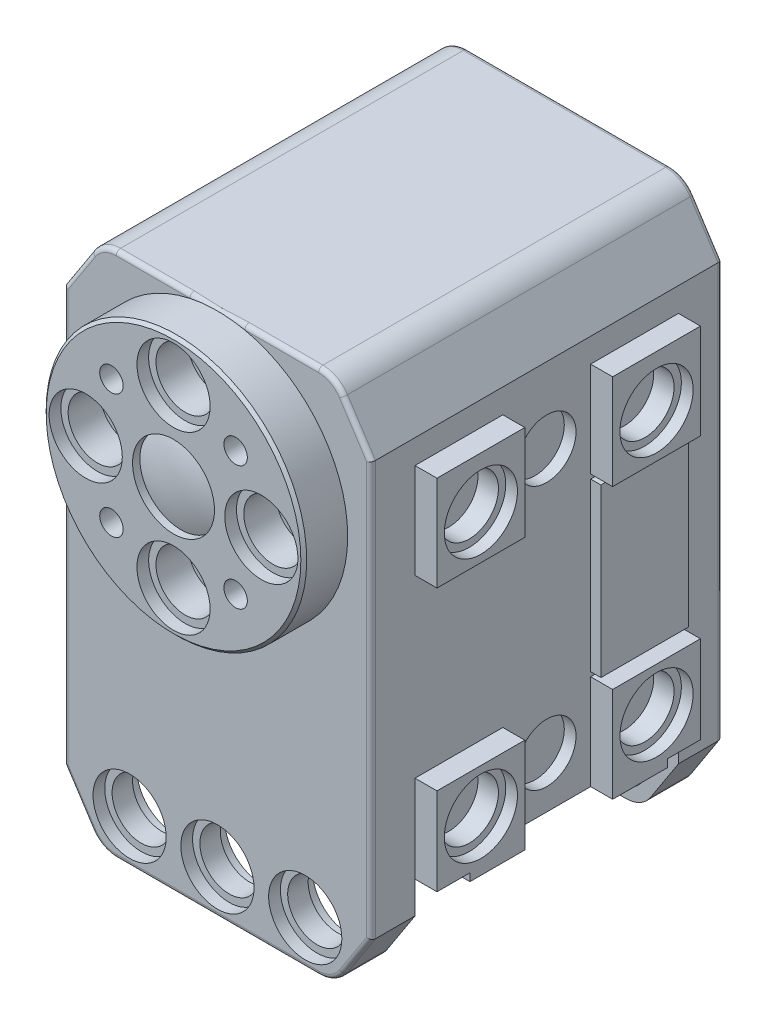
from build123d import *

# Parameters (mm, degrees)
BOSS_EXTRU_1_START                                = -18.75
BOSS_EXTRU_1_DEPTH                                = 18.75
BOSS_EXTRU_1_2_OUTLINE_R                          = 8.9
BOSS_EXTRU_1_2_OUTLINE_R_2                        = 2.8
BOSS_EXTRU_1_2_DEPTH                              = 3
BOSS_EXTRU_1_3_OUTLINE_R                          = 2.8
BOSS_EXTRU_1_3_DEPTH                              = 2.4999999
ENL_V_MAT_EXTRU_1_DEPTH                           = 13.5
ENL_V_MAT_EXTRU_2_DEPTH                           = 2.25
BOSS_EXTRU_2_DEPTH                                = 1.5
BOSS_EXTRU_3_DEPTH                                = 1.5
ESQUISSE6_W                                       = 1.5
ESQUISSE6_H                                       = 6.5
ENL_V_MAT_EXTRU_3_DEPTH                           = 6
ESQUISSE7_W                                       = 1.5
ESQUISSE7_H                                       = 15.75
ENL_V_MAT_EXTRU_4_DEPTH                           = 20.15033759
ESQUISSE8_W                                       = 1.5
ESQUISSE8_H                                       = 6.5
ENL_V_MAT_EXTRU_5_DEPTH                           = 6
ESQUISSE9_W                                       = 1.5
ESQUISSE9_H                                       = 3.75
ENL_V_MAT_EXTRU_6_DEPTH                           = 20.15033759
BOSS_EXTRU_4_START                                = 2.25
BOSS_EXTRU_4_DEPTH                                = 2.25
BOSS_EXTRU_5_DEPTH                                = 3
ENL_V_START                                       = -0.8
ESQUISSE12_R                                      = 2.5
ENL_V_MAT_EXTRU_7_DEPTH                           = 0.8
ESQUISSE13_R                                      = 2.5
ENL_V_MAT_EXTRU_8_DEPTH                           = 0.8
ENL_V_MAT_EXTRU_9_REACH                           = 41.49
ESQUISSE14_R                                      = 2
ESQUISSE17_R                                      = 2.5
ENL_V_MAT_EXTRU_10_DEPTH                          = 0.8
ESQUISSE18_R                                      = 2.5
ENL_V_MAT_EXTRU_11_DEPTH                          = 0.8
ENL_V_MAT_EXTRU_12_REACH                          = 41.49
ESQUISSE19_R                                      = 2
ESQUISSE20_W                                      = 6
ESQUISSE20_H                                      = 6.5
BOSS_EXTRU_6_DEPTH                                = 1.5
ESQUISSE21_W                                      = 6
ESQUISSE21_H                                      = 6.5
BOSS_EXTRU_7_DEPTH                                = 1.5
ESQUISSE22_W                                      = 6
ESQUISSE22_H                                      = 11.4
BOSS_EXTRU_8_DEPTH                                = 0.7
ESQUISSE23_W                                      = 6
ESQUISSE23_H                                      = 6.5
BOSS_EXTRU_9_DEPTH                                = 1.5
ESQUISSE24_W                                      = 6
ESQUISSE24_H                                      = 6.5
BOSS_EXTRU_10_DEPTH                               = 1.5
ESQUISSE25_W                                      = 6
ESQUISSE25_H                                      = 11.4
BOSS_EXTRU_11_DEPTH                               = 0.7
CHAMBRAGE_POUR_VIS_T_TE_HEXAGONALE_M3_D           = 4
CHAMBRAGE_POUR_VIS_T_TE_HEXAGONALE_M3_DEPTH       = 3
CHAMBRAGE_POUR_VIS_T_TE_HEXAGONALE_M3_CBORE_D     = 5
CHAMBRAGE_POUR_VIS_T_TE_HEXAGONALE_M3_CBORE_DEPTH = 0.8
DIAM_TRE_DU_PER_AGE_4_0_4_1_D                     = 4
DIAM_TRE_DU_PER_AGE_4_0_4_1_DEPTH                 = 0.8
DIAM_TRE_DU_PER_AGE_4_0_4_2_D                     = 4
DIAM_TRE_DU_PER_AGE_4_0_4_2_DEPTH                 = 0.8
CHAMBRAGE_POUR_VIS_T_TE_HEXAGONALE_2_D            = 4
CHAMBRAGE_POUR_VIS_T_TE_HEXAGONALE_2_DEPTH        = 2.2
CHAMBRAGE_POUR_VIS_T_TE_HEXAGONALE_2_CBORE_D      = 5
CHAMBRAGE_POUR_VIS_T_TE_HEXAGONALE_2_CBORE_DEPTH  = 0.8
DIAM_TRE_DU_PER_AGE_1_6_1_6_1_D                   = 1.6
DIAM_TRE_DU_PER_AGE_1_6_1_6_1_DEPTH               = 3
CHAMBRAGE_POUR_VIS_T_TE_HEXAGONALE_3_D            = 4
CHAMBRAGE_POUR_VIS_T_TE_HEXAGONALE_3_DEPTH        = 2.2
CHAMBRAGE_POUR_VIS_T_TE_HEXAGONALE_3_CBORE_D      = 5
CHAMBRAGE_POUR_VIS_T_TE_HEXAGONALE_3_CBORE_DEPTH  = 0.8
CHAMBRAGE_POUR_VIS_T_TE_HEXAGONALE_4_D            = 4
CHAMBRAGE_POUR_VIS_T_TE_HEXAGONALE_4_DEPTH        = 3
CHAMBRAGE_POUR_VIS_T_TE_HEXAGONALE_4_CBORE_D      = 5
CHAMBRAGE_POUR_VIS_T_TE_HEXAGONALE_4_CBORE_DEPTH  = 0.8
CONG_1_R                                          = 2
CHANFREIN3_SIZE                                   = 0.2
CONG_2_R                                          = 0.3


with BuildPart() as part:
    # Boss.-Extru.1: read off the stored shape, not the designer's step
    # Boss.-Extru.1 outline → Boss.-Extru.1 (new body)
    with BuildSketch(Plane.XY.offset(12).offset(BOSS_EXTRU_1_START)):
        Polygon((-8, -27), (8, -27), (10.5, -23.15033759), (10.5, 5.15033759), (8, 9), (-8, 9), (-10.5, 5.15033759), (-10.5, -23.15033759), align=None)
    extrude(amount=BOSS_EXTRU_1_DEPTH)

    # Boss.-Extru.1 2 outline → Boss.-Extru.1 2 (add)
    with BuildSketch(Plane.XY.offset(12)):
        Circle(BOSS_EXTRU_1_2_OUTLINE_R)
        Circle(BOSS_EXTRU_1_2_OUTLINE_R_2, mode=Mode.SUBTRACT)
    extrude(amount=BOSS_EXTRU_1_2_DEPTH)

    # Boss.-Extru.1 3 outline → Boss.-Extru.1 3 (add)
    with BuildSketch(Plane.XY.offset(12)):
        Circle(BOSS_EXTRU_1_3_OUTLINE_R)
    extrude(amount=BOSS_EXTRU_1_3_DEPTH)

    # Boss.-Extru.1 4 outline → Boss.-Extru.1 4 (revolve)
    with BuildSketch(Plane.XZ):
        with BuildLine():
            Line((0, 14.4999999), (2.8, 14.5))
            ThreePointArc((2.8, 14.5), (1.422146265, 14.874019086), (0, 15))
            Line((0, 15), (0, 14.4999999))
        make_face()
    revolve(axis=Axis((0, 0, 0), (0, 0, 1)))

    # Esquisse2 → Enlèv. mat.-Extru.1 (cut)
    with BuildSketch(Plane(origin=(0, 0, -6.75), x_dir=(-1, 0, 0), z_dir=(0, 0, -1))):
        with BuildLine():
            Line((-6, -21.5), (-10.5, -21.5))
            Line((-10.5, -21.5), (-10.5, -23.15033759))
            Line((-10.5, -23.15033759), (-8, -27))
            Line((-8, -27), (8, -27))
            Line((8, -27), (10.5, -23.15033759))
            Line((10.5, -23.15033759), (10.5, -21.5))
            Line((10.5, -21.5), (6, -21.5))
            ThreePointArc((6, -21.5), (4.881966011, -21.763932023), (4, -22.5))
            Line((4, -22.5), (-4, -22.5))
            ThreePointArc((-4, -22.5), (-4.881966011, -21.763932023), (-6, -21.5))
        make_face()
    extrude(amount=-ENL_V_MAT_EXTRU_1_DEPTH, mode=Mode.SUBTRACT)

    # Esquisse3 → Enlèv. mat.-Extru.2 (cut)
    with BuildSketch(Plane(origin=(0, 0, 6.75), x_dir=(-1, 0, 0), z_dir=(0, 0, -1))):
        with BuildLine():
            Line((-6, -20.975), (-10.5, -20.975))
            Line((-10.5, -20.975), (-10.5, -23.15033759))
            Line((-10.5, -23.15033759), (-8, -27))
            Line((-8, -27), (8, -27))
            Line((8, -27), (10.5, -23.15033759))
            Line((10.5, -23.15033759), (10.5, -20.975))
            Line((10.5, -20.975), (6, -20.975))
            ThreePointArc((6, -20.975), (4.48126286, -21.383884081), (3.373095929, -22.5))
            Line((3.373095929, -22.5), (-3.373095929, -22.5))
            ThreePointArc((-3.373095929, -22.5), (-4.48126286, -21.383884081), (-6, -20.975))
        make_face()
    extrude(amount=-ENL_V_MAT_EXTRU_2_DEPTH, mode=Mode.SUBTRACT)

    # Esquisse4 → Boss.-Extru.2 (add)
    with BuildSketch(Plane(origin=(10.5, 0, 0), x_dir=(0, 0, -1), z_dir=(1, 0, 0))):
        Polygon((-9, -20.975), (-9, 5.15033759), (6.75, 5.15033759), (6.75, -21.5), (-6.75, -21.5), (-6.75, -20.975), align=None)
    extrude(amount=BOSS_EXTRU_2_DEPTH)

    # Esquisse5 → Boss.-Extru.3 (add)
    with BuildSketch(Plane.ZY.offset(10.5)):
        Polygon((-3, 5.15033759), (-3, -15), (9, -15), (9, -20.975), (6.75, -20.975), (6.75, -21.5), (-6.75, -21.5), (-6.75, 5.15033759), align=None)
    extrude(amount=BOSS_EXTRU_3_DEPTH)

    # Esquisse6 → Enlèv. mat.-Extru.3 (cut)
    with BuildSketch(Plane(origin=(0, 0, -3), x_dir=(-1, 0, 0), z_dir=(0, 0, -1))):
        with Locations((11.25, -18.25)):
            Rectangle(ESQUISSE6_W, ESQUISSE6_H)
    extrude(amount=-ENL_V_MAT_EXTRU_3_DEPTH, mode=Mode.SUBTRACT)

    # Esquisse7 → Enlèv. mat.-Extru.4 (cut)
    with BuildSketch(Plane(origin=(0, 5.15033759, 0), x_dir=(-1, 0, 0), z_dir=(0, 1, 0))):
        with Locations((-11.25, 1.125)):
            Rectangle(ESQUISSE7_W, ESQUISSE7_H)
    extrude(amount=-ENL_V_MAT_EXTRU_4_DEPTH, mode=Mode.SUBTRACT)

    # Esquisse8 → Enlèv. mat.-Extru.5 (cut)
    with BuildSketch(Plane.XY.offset(3)):
        with Locations((11.25, -18.25)):
            Rectangle(ESQUISSE8_W, ESQUISSE8_H)
    extrude(amount=-ENL_V_MAT_EXTRU_5_DEPTH, mode=Mode.SUBTRACT)

    # Esquisse9 → Enlèv. mat.-Extru.6 (cut)
    with BuildSketch(Plane(origin=(0, 5.15033759, 0), x_dir=(-1, 0, 0), z_dir=(0, 1, 0))):
        with Locations((11.25, -4.875)):
            Rectangle(ESQUISSE9_W, ESQUISSE9_H)
    extrude(amount=-ENL_V_MAT_EXTRU_6_DEPTH, mode=Mode.SUBTRACT)

    # Esquisse10 → Boss.-Extru.4 (add)
    with BuildSketch(Plane(origin=(0, 0, -6.75), x_dir=(-1, 0, 0), z_dir=(0, 0, -1)).offset(BOSS_EXTRU_4_START)):
        with BuildLine():
            Line((12, -20.975), (6, -20.975))
            ThreePointArc((6, -20.975), (4.48126286, -21.383884081), (3.373095929, -22.5))
            Line((3.373095929, -22.5), (-3.373095929, -22.5))
            ThreePointArc((-3.373095929, -22.5), (-4.48126286, -21.383884081), (-6, -20.975))
            Line((-6, -20.975), (-12, -20.975))
            Line((-12, -20.975), (-12, -15))
            Line((-12, -15), (-10.5, -15))
            Line((-10.5, -15), (-10.5, 5.15033759))
            Line((-10.5, 5.15033759), (-8, 9))
            Line((-8, 9), (8, 9))
            Line((8, 9), (10.5, 5.15033759))
            Line((10.5, 5.15033759), (10.5, -15))
            Line((10.5, -15), (12, -15))
            Line((12, -15), (12, -20.975))
        make_face()
    extrude(amount=-BOSS_EXTRU_4_DEPTH)

    # Esquisse11 → Boss.-Extru.5 (add)
    with BuildSketch(Plane(origin=(0, 0, -9), x_dir=(-1, 0, 0), z_dir=(0, 0, -1))):
        Polygon((-8, 9), (8, 9), (10.5, 5.15033759), (10.5, -23.15033759), (8, -27), (-8, -27), (-10.5, -23.15033759), (-10.5, 5.15033759), align=None)
    extrude(amount=BOSS_EXTRU_5_DEPTH)

    # Esquisse12 → Enlèv. mat.-Extru.7 (cut)
    with BuildSketch(Plane.XY.offset(-9).offset(ENL_V_START)):
        with Locations(Location((-6, -24, 0), (0, 0, 180))):
            Circle(ESQUISSE12_R)
    extrude(amount=ENL_V_MAT_EXTRU_7_DEPTH, mode=Mode.SUBTRACT)

    # Esquisse13 → Enlèv. mat.-Extru.8 (cut)
    with BuildSketch(Plane(origin=(0, 0, -12), x_dir=(-1, 0, 0), z_dir=(0, 0, -1))):
        with Locations((6, -24)):
            Circle(ESQUISSE13_R)
    extrude(amount=-ENL_V_MAT_EXTRU_8_DEPTH, mode=Mode.SUBTRACT)

    # Esquisse14 → Enlèv. mat.-Extru.9 (cut, up to next)
    with BuildSketch(Plane(origin=(0, 0, -11.2), x_dir=(-1, 0, 0), z_dir=(0, 0, -1)), mode=Mode.PRIVATE) as enl_v_mat_extru_9_sk1:
        with Locations((6, -24)):
            Circle(ESQUISSE14_R)
    enl_v_mat_extru_9_tool1 = extrude(enl_v_mat_extru_9_sk1.sketch, amount=-ENL_V_MAT_EXTRU_9_REACH, mode=Mode.PRIVATE) & part.part
    add(enl_v_mat_extru_9_tool1.solids().sort_by_distance((-6, -24, -11.2))[0], mode=Mode.SUBTRACT)

    # Esquisse15 → Trou taraudé M4x0.71 (revolve, cut)
    with BuildSketch(Plane(origin=(0, -24, -9), x_dir=(0, -1, 0), z_dir=(1, 0, 0))):
        Polygon((0, 0), (0, 2.2), (2.5, 2.2), (2.5, 1.4), (2, 1.4), (2, 0), align=None)
    revolve(axis=Axis((0, -24, -2.65), (0, 0, -1)), mode=Mode.SUBTRACT)

    # Esquisse17 → Enlèv. mat.-Extru.10 (cut)
    with BuildSketch(Plane.XY.offset(-9).offset(ENL_V_START)):
        with Locations(Location((6, -24, 0), (0, 0, 180))):
            Circle(ESQUISSE17_R)
    extrude(amount=ENL_V_MAT_EXTRU_10_DEPTH, mode=Mode.SUBTRACT)

    # Esquisse18 → Enlèv. mat.-Extru.11 (cut)
    with BuildSketch(Plane(origin=(0, 0, -12), x_dir=(-1, 0, 0), z_dir=(0, 0, -1))):
        with Locations((-6, -24)):
            Circle(ESQUISSE18_R)
    extrude(amount=-ENL_V_MAT_EXTRU_11_DEPTH, mode=Mode.SUBTRACT)

    # Esquisse19 → Enlèv. mat.-Extru.12 (cut, up to next)
    with BuildSketch(Plane(origin=(0, 0, -11.2), x_dir=(-1, 0, 0), z_dir=(0, 0, -1)), mode=Mode.PRIVATE) as enl_v_mat_extru_12_sk1:
        with Locations((-6, -24)):
            Circle(ESQUISSE19_R)
    enl_v_mat_extru_12_tool1 = extrude(enl_v_mat_extru_12_sk1.sketch, amount=-ENL_V_MAT_EXTRU_12_REACH, mode=Mode.PRIVATE) & part.part
    add(enl_v_mat_extru_12_tool1.solids().sort_by_distance((6, -24, -11.2))[0], mode=Mode.SUBTRACT)

    # Esquisse20 → Boss.-Extru.6 (add)
    with BuildSketch(Plane(origin=(10.5, 0, 0), x_dir=(0, 0, -1), z_dir=(1, 0, 0))):
        with Locations((6, 0.25)):
            Rectangle(ESQUISSE20_W, ESQUISSE20_H)
    extrude(amount=BOSS_EXTRU_6_DEPTH)

    # Esquisse21 → Boss.-Extru.7 (add)
    with BuildSketch(Plane(origin=(10.5, 0, 0), x_dir=(0, 0, -1), z_dir=(1, 0, 0))):
        with Locations((-6, 0.25)):
            Rectangle(ESQUISSE21_W, ESQUISSE21_H)
    extrude(amount=BOSS_EXTRU_7_DEPTH)

    # Esquisse22 → Boss.-Extru.8 (add)
    with BuildSketch(Plane(origin=(10.5, 0, 0), x_dir=(0, 0, -1), z_dir=(1, 0, 0))):
        with Locations((6, -9)):
            Rectangle(ESQUISSE22_W, ESQUISSE22_H)
    extrude(amount=BOSS_EXTRU_8_DEPTH)

    # Esquisse23 → Boss.-Extru.9 (add)
    with BuildSketch(Plane.ZY.offset(10.5)):
        with Locations((-6, 0.25)):
            Rectangle(ESQUISSE23_W, ESQUISSE23_H)
    extrude(amount=BOSS_EXTRU_9_DEPTH)

    # Esquisse24 → Boss.-Extru.10 (add)
    with BuildSketch(Plane.ZY.offset(10.5)):
        with Locations((6, 0.25)):
            Rectangle(ESQUISSE24_W, ESQUISSE24_H)
    extrude(amount=BOSS_EXTRU_10_DEPTH)

    # Esquisse25 → Boss.-Extru.11 (add)
    with BuildSketch(Plane.ZY.offset(10.5)):
        with Locations((-6, -9)):
            Rectangle(ESQUISSE25_W, ESQUISSE25_H)
    extrude(amount=BOSS_EXTRU_11_DEPTH)

    # Esquisse26 → Enlèvement de matière-Révolution1 (revolve, cut)
    with BuildSketch(Plane(origin=(0, -24, 0), x_dir=(1, 0, 0), z_dir=(0, 1, 0))):
        Polygon((8.5, -9), (6, -9), (6, -12), (8.5, -12), (8.5, -11.2), (8, -11.2), (8, -9.8), (8.5, -9.8), align=None)
    revolve(axis=Axis((6, -24, 9), (0, 0, 1)), mode=Mode.SUBTRACT)

    # Esquisse27 → Enlèvement de matière-Révolution2 (revolve, cut)
    with BuildSketch(Plane(origin=(0, -24, 0), x_dir=(1, 0, 0), z_dir=(0, 1, 0))):
        Polygon((-3.5, -9), (-6, -9), (-6, -12), (-3.5, -12), (-3.5, -11.2), (-4, -11.2), (-4, -9.8), (-3.5, -9.8), align=None)
    revolve(axis=Axis((-6, -24, 9), (0, 0, 1)), mode=Mode.SUBTRACT)

    # Esquisse28 → Enlèvement de matière-Révolution3 (revolve, cut)
    with BuildSketch(Plane(origin=(0, -24, 0), x_dir=(1, 0, 0), z_dir=(0, 1, 0))):
        Polygon((2.5, -9), (0, -9), (0, -12), (2.5, -12), (2.5, -11.2), (2, -11.2), (2, -9.8), (2.5, -9.8), align=None)
    revolve(axis=Axis((0, -24, 9), (0, 0, 1)), mode=Mode.SUBTRACT)

    # Chambrage pour vis _ t_te hexagonale M3
    with Locations(Plane(origin=(0, 0, -12), x_dir=(-1, 0, 0), z_dir=(0, 0, -1))):
        with Locations((6, 0), (0, 0), (-6, 0)):
            CounterBoreHole(CHAMBRAGE_POUR_VIS_T_TE_HEXAGONALE_M3_D / 2, CHAMBRAGE_POUR_VIS_T_TE_HEXAGONALE_M3_CBORE_D / 2, CHAMBRAGE_POUR_VIS_T_TE_HEXAGONALE_M3_CBORE_DEPTH, depth=CHAMBRAGE_POUR_VIS_T_TE_HEXAGONALE_M3_DEPTH)

    # Diamètre du perçage Ø4.0 (4)1
    with Locations(Plane.ZY.offset(10.5)):
        with Locations((0, 0), (0, -18)):
            Hole(DIAM_TRE_DU_PER_AGE_4_0_4_1_D / 2, depth=DIAM_TRE_DU_PER_AGE_4_0_4_1_DEPTH)

    # Diamètre du perçage Ø4.0 (4)2
    with Locations(Plane(origin=(10.5, 0, 0), x_dir=(0, 0, -1), z_dir=(1, 0, 0))):
        with Locations((0, 0), (0, -18)):
            Hole(DIAM_TRE_DU_PER_AGE_4_0_4_2_D / 2, depth=DIAM_TRE_DU_PER_AGE_4_0_4_2_DEPTH)

    # Chambrage pour vis _ t_te hexagonale 2
    with Locations(Plane.ZY.offset(12)):
        with Locations((6, -18), (-6, -18), (-6, 0), (6, 0)):
            CounterBoreHole(CHAMBRAGE_POUR_VIS_T_TE_HEXAGONALE_2_D / 2, CHAMBRAGE_POUR_VIS_T_TE_HEXAGONALE_2_CBORE_D / 2, CHAMBRAGE_POUR_VIS_T_TE_HEXAGONALE_2_CBORE_DEPTH, depth=CHAMBRAGE_POUR_VIS_T_TE_HEXAGONALE_2_DEPTH)

    # Diamètre du perçage Ø1.6 (1.6)1
    with Locations(Plane.XY.offset(15)):
        with Locations((4.242640687, 4.242640687), (-4.242640687, 4.242640687), (4.242640687, -4.242640687), (-4.242640687, -4.242640687)):
            Hole(DIAM_TRE_DU_PER_AGE_1_6_1_6_1_D / 2, depth=DIAM_TRE_DU_PER_AGE_1_6_1_6_1_DEPTH)

    # Chambrage pour vis _ t_te hexagonale 3
    with Locations(Plane(origin=(12, 0, 0), x_dir=(0, 0, -1), z_dir=(1, 0, 0))):
        with Locations((6, -18), (-6, -18), (6, 0), (-6, 0)):
            CounterBoreHole(CHAMBRAGE_POUR_VIS_T_TE_HEXAGONALE_3_D / 2, CHAMBRAGE_POUR_VIS_T_TE_HEXAGONALE_3_CBORE_D / 2, CHAMBRAGE_POUR_VIS_T_TE_HEXAGONALE_3_CBORE_DEPTH, depth=CHAMBRAGE_POUR_VIS_T_TE_HEXAGONALE_3_DEPTH)

    # Chambrage pour vis _ t_te hexagonale 4
    with Locations(Plane.XY.offset(15)):
        with Locations((6, 0), (0, 6), (-6, 0), (0, -6)):
            CounterBoreHole(CHAMBRAGE_POUR_VIS_T_TE_HEXAGONALE_4_D / 2, CHAMBRAGE_POUR_VIS_T_TE_HEXAGONALE_4_CBORE_D / 2, CHAMBRAGE_POUR_VIS_T_TE_HEXAGONALE_4_CBORE_DEPTH, depth=CHAMBRAGE_POUR_VIS_T_TE_HEXAGONALE_4_DEPTH)

    # Congé1
    cong_1_edges = [part.edges().sort_by_distance(p)[0] for p in [
        (-8, 9, 2.625),
        (8, 9, 2.625),
        (-8, -27, 10.5),
        (8, -27, 10.5),
        (8, -27, -10.5),
        (-8, -27, -10.5),
    ]]
    fillet(cong_1_edges, radius=CONG_1_R)

    # Chanfrein3
    chanfrein3_edges = [part.edges().sort_by_distance(p)[0] for p in [
        (-8.9, 0, 15),
    ]]
    chamfer(chanfrein3_edges, length=CHANFREIN3_SIZE)

    # Congé2
    cong_2_edges = [part.edges().sort_by_distance(p)[0] for p in [
        (10.5, -9, 12),
        (9.545714868, 6.61980783, 12),
        (-10.5, -9, 12),
        (-9.545714868, -24.61980783, 12),
        (10.5, -9, -12),
        (9.545714868, -24.61980783, -12),
        (-10.5, -9, -12),
        (-9.545714868, 6.61980783, -12),
        (0, -27, -12),
        (9.545714868, 6.61980783, -12),
        (-9.545714868, -24.61980783, -12),
        (0, 9, -12),
        (-7.868406121, -26.757634225, -12),
        (-7.868406121, 8.757634225, -12),
        (7.868406121, 8.757634225, -12),
        (7.868406121, -26.757634225, -12),
        (0, -27, 12),
        (9.545714868, -24.61980783, 12),
        (0, 9, 12),
        (-9.545714868, 6.61980783, 12),
        (-7.868406121, -26.757634225, 12),
        (-7.868406121, 8.757634225, 12),
        (7.868406121, 8.757634225, 12),
        (7.868406121, -26.757634225, 12),
    ]]
    fillet(cong_2_edges, radius=CONG_2_R)


solid = part.part
